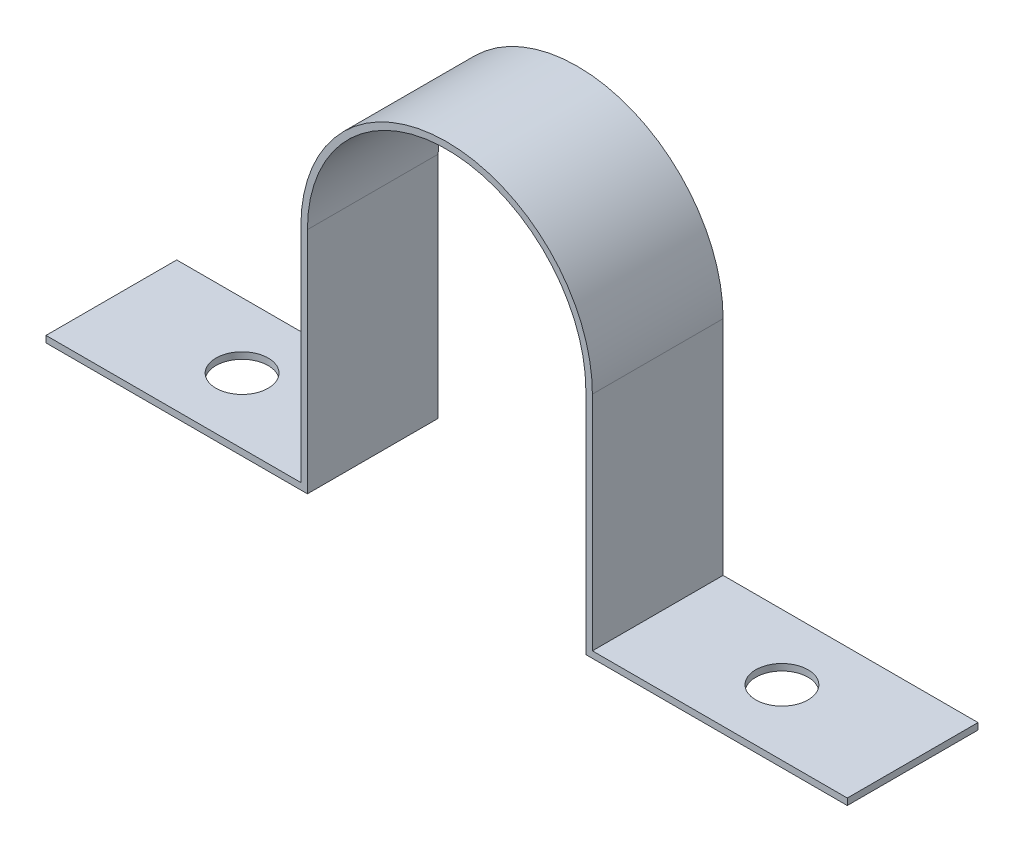
from build123d import *

# Parameters (mm, degrees)
SALIENTE_EXTRUIR1_DEPTH = 10
CROQUIS2_R              = 2
CORTAR_EXTRUIR1_DEPTH   = 10


with BuildPart() as part:
    # Croquis1 → Saliente-Extruir1 (new body)
    with BuildSketch(Plane.XY):
        with BuildLine():
            Line((-11.15, 0), (-11.15, -17.007351352))
            Line((-11.15, -17.007351352), (-30.65, -17.007351352))
            Line((-30.65, -17.007351352), (-30.65, -17.507351352))
            Line((-30.65, -17.507351352), (-10.65, -17.507351352))
            Line((-10.65, -17.507351352), (-10.65, 0))
            ThreePointArc((-10.65, 0), (0, 10.65), (10.65, 0))
            Line((10.65, 0), (10.65, -17.507351352))
            Line((10.65, -17.507351352), (30.65, -17.507351352))
            Line((30.65, -17.507351352), (30.65, -17.007351352))
            Line((30.65, -17.007351352), (11.15, -17.007351352))
            Line((11.15, -17.007351352), (11.15, 0))
            ThreePointArc((11.15, 0), (0, 11.15), (-11.15, 0))
        make_face()
    extrude(amount=SALIENTE_EXTRUIR1_DEPTH)

    # Croquis2 → Cortar-Extruir1 (cut)
    with BuildSketch(Plane(origin=(0, -17.007351352, 0), x_dir=(1, 0, 0), z_dir=(0, 1, 0))):
        with Locations((-20.65, -5)):
            Circle(CROQUIS2_R)
        with Locations((20.65, -5)):
            Circle(CROQUIS2_R)
    extrude(amount=-CORTAR_EXTRUIR1_DEPTH, mode=Mode.SUBTRACT)


solid = part.part
